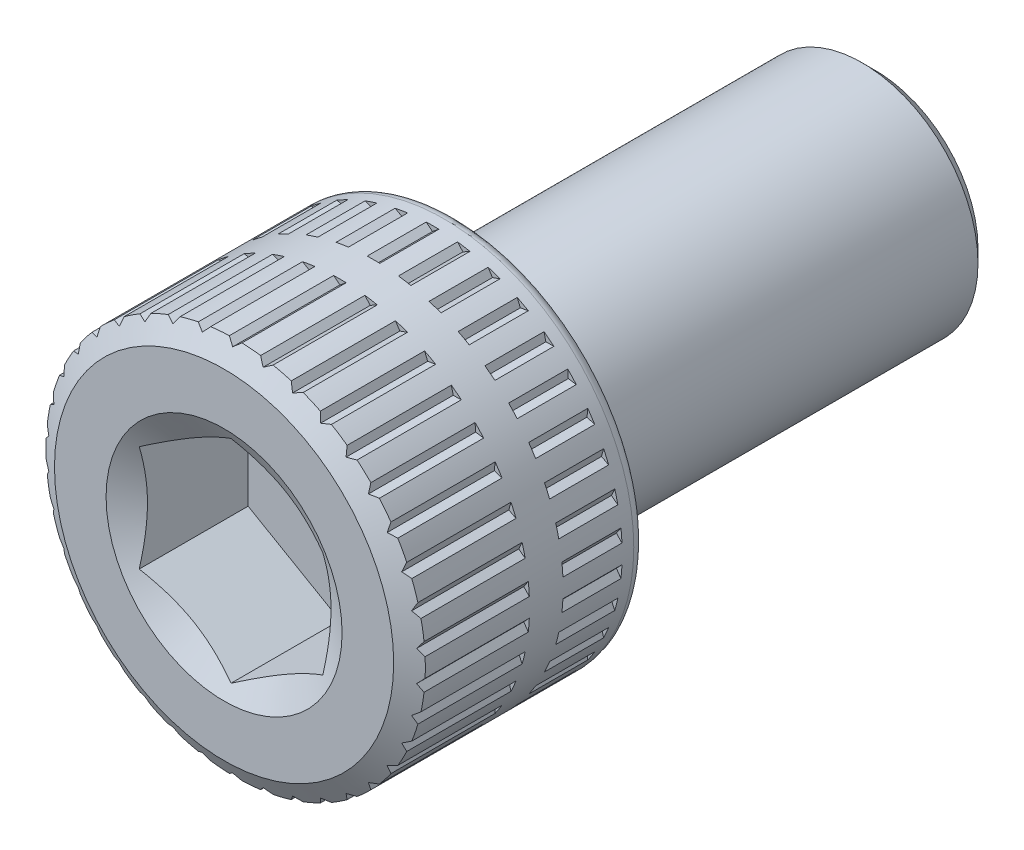
from build123d import *

# Parameters (mm, degrees)
CUT_EXTRUDE1_START = 4.9276
CUT_EXTRUDE1_DEPTH = 1.7526
CHAMFER1_SIZE      = 0.17526
CHAMFER1_SIZE_2    = 0.303559225
CUT_EXTRUDE3_START = -0.893826
CUT_EXTRUDE3_DEPTH = 0.893826
CUT_EXTRUDE4_START = -1.40208
CUT_EXTRUDE4_DEPTH = 7.432016342
CIRPATTERN1_COUNT  = 38


# Read off the part's stored shape, not the designer's step: DeleteFace1
with BuildPart() as part:
    # Sketch2 → Revolve1 (revolve)
    with BuildSketch(Plane(origin=(0, 0, 0), x_dir=(0, 0, -1), z_dir=(1, 0, 0)), mode=Mode.PRIVATE) as revolve1_sk:
        with BuildLine():
            Line((4.9276, 0), (4.9276, 1.5541625))
            Line((4.9276, 1.5541625), (4.7291625, 1.7526))
            Line((4.7291625, 1.7526), (-1.4224, 1.7526))
            Line((-1.4224, 1.7526), (-1.4224, 2.69494))
            ThreePointArc((-1.4224, 2.69494), (-1.473732466, 2.818867534), (-1.59766, 2.8702))
            Line((-1.59766, 2.8702), (-4.75234, 2.8702))
            ThreePointArc((-4.75234, 2.8702), (-4.876267534, 2.818867534), (-4.9276, 2.69494))
            Line((-4.9276, 2.69494), (-4.9276, 0))
            Line((-4.9276, 0), (4.9276, 0))
        make_face()
    revolve(revolve1_sk.sketch.rotate(Axis((0, 0, -4.9276), (0, 0, 1)), 90), axis=Axis((0, 0, -4.9276), (0, 0, 1)))

    # Sketch3 → Cut-Extrude1 (cut)
    with BuildSketch(Plane.XY.offset(CUT_EXTRUDE1_START)):
        Polygon((-1.3890625, 0.801975608), (-1.3890625, -0.801975608), (0, -1.603951217), (1.3890625, -0.801975608), (1.3890625, 0.801975608), (0, 1.603951217), align=None)
    extrude(amount=-CUT_EXTRUDE1_DEPTH, mode=Mode.SUBTRACT)

    # Cut-Extrude2 cone 1 section (through the dimple's axis) → Cut-Extrude2 (revolve, cut)
    with BuildSketch(Plane(origin=(0, 0, 4.9276), x_dir=(0, -1, 0), z_dir=(1, 0, 0))):
        Polygon((0, 0), (1.78578268, 0), (0, 1.031022111), align=None)
    revolve(axis=Axis((0, 0, 4.9276), (0, 0, -1)), mode=Mode.SUBTRACT)

    # DeleteFace1 outline → DeleteFace1 (revolve)
    with BuildSketch(Plane.XZ):
        with BuildLine():
            Line((2.8702, 4.9276), (2.69494, 4.9276))
            ThreePointArc((2.69494, 4.9276), (2.818867534, 4.876267534), (2.8702, 4.75234))
            Line((2.8702, 4.75234), (2.8702, 4.9276))
        make_face()
    revolve(axis=Axis((0, 0, 0), (0, 0, 1)))

    # Chamfer1
    # the kernel refuses this chamfer: 0.303559225, 0.17526 mm, written as the material it takes off along each edge
    with BuildSketch(Plane(origin=(0, 0, 4.9276), x_dir=(1, 0, 0), z_dir=(0, -1, 0))) as chamfer1_piece_1:
        Polygon((2.8702, -CHAMFER1_SIZE), (2.8702 - CHAMFER1_SIZE_2 * 0.999999998467, 0), (2.8702, 0), align=None)
    revolve(axis=Axis((0, 0, 4.9276), (0, 0, 1)), mode=Mode.SUBTRACT)

    # Sketch8 → Cut-Extrude3 (cut)
    with BuildSketch(Plane(origin=(0, 0, 1.77292), x_dir=(-1, 0, 0), z_dir=(0, 0, -1)).offset(CUT_EXTRUDE3_START)):
        with BuildLine():
            Line((-0.09525, 2.868619089), (0, 2.792419089))
            Line((0, 2.792419089), (0.09525, 2.868619089))
            ThreePointArc((0.09525, 2.868619089), (0, 2.8702), (-0.09525, 2.868619089))
        make_face()
    cut_extrude3 = extrude(amount=CUT_EXTRUDE3_DEPTH, mode=Mode.SUBTRACT)

    # Sketch8<4> → Cut-Extrude4 (cut, through all)
    with BuildSketch(Plane(origin=(0, 0, 1.77292), x_dir=(-1, 0, 0), z_dir=(0, 0, -1)).offset(CUT_EXTRUDE4_START)):
        with BuildLine():
            Line((-0.09525, 2.868619089), (0, 2.792419089))
            Line((0, 2.792419089), (0.09525, 2.868619089))
            ThreePointArc((0.09525, 2.868619089), (0, 2.8702), (-0.09525, 2.868619089))
        make_face()
    cut_extrude4 = extrude(amount=-CUT_EXTRUDE4_DEPTH, mode=Mode.SUBTRACT)

    # CirPattern1: Cut-Extrude3, Cut-Extrude4 ×38 about axis
    cirpattern1_axis = Axis((0, 0, 0), (0, 0, 1))
    add([cut_extrude3.rotate(cirpattern1_axis, i * 360 / CIRPATTERN1_COUNT) for i in range(1, CIRPATTERN1_COUNT)], mode=Mode.SUBTRACT)
    add([cut_extrude4.rotate(cirpattern1_axis, i * 360 / CIRPATTERN1_COUNT) for i in range(1, CIRPATTERN1_COUNT)], mode=Mode.SUBTRACT)


solid = part.part
